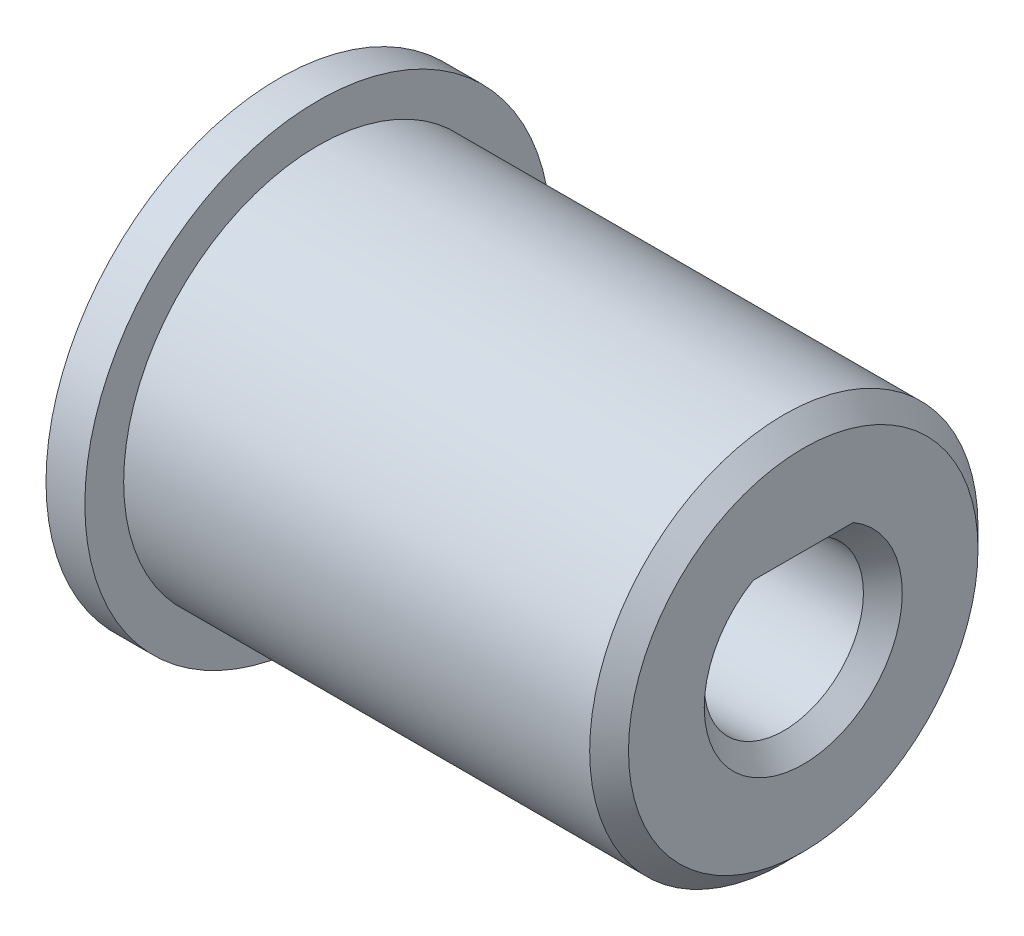
from build123d import *

# Parameters (mm, degrees)
SKIZZE2_R                            = 10
AUFSATZ_LINEAR_AUSTRAGEN1_DEPTH      = 25
SKIZZE3_R                            = 12
AUFSATZ_LINEAR_AUSTRAGEN2_DEPTH      = 2
SCHNITT_LINEAR_AUSTRAGEN1_DEPTH      = 15
FASE1_SIZE                           = 1
FASE2_SIZE                           = 1
F_3_1_3_1_DURCHMESSER_BOHRUNG1_D     = 3.1
F_3_1_3_1_DURCHMESSER_BOHRUNG1_DEPTH = 7
F_3_1_3_1_DURCHMESSER_BOHRUNG1_TIP   = 0.931333959
FASE3_SIZE                           = 1


with BuildPart() as part:
    # Skizze2 → Aufsatz-Linear austragen1 (new body)
    with BuildSketch(Plane(origin=(0, 0, 0), x_dir=(0, 0, -1), z_dir=(1, 0, 0))):
        Circle(SKIZZE2_R)
    extrude(amount=AUFSATZ_LINEAR_AUSTRAGEN1_DEPTH)

    # Skizze3 → Aufsatz-Linear austragen2 (add)
    with BuildSketch(Plane.ZY):
        Circle(SKIZZE3_R)
    extrude(amount=AUFSATZ_LINEAR_AUSTRAGEN2_DEPTH)

    # Skizze4 → Schnitt-Linear austragen1 (cut)
    with BuildSketch(Plane(origin=(25, 0, 0), x_dir=(0, 0, -1), z_dir=(1, 0, 0))):
        with BuildLine():
            Line((-2.291287847, 3.4), (2.291287847, 3.4))
            ThreePointArc((2.291287847, 3.4), (0, -4.1), (-2.291287847, 3.4))
        make_face()
    extrude(amount=-SCHNITT_LINEAR_AUSTRAGEN1_DEPTH, mode=Mode.SUBTRACT)

    # Fase1
    fase1_edges = [part.edges().sort_by_distance(p)[0] for p in [
        (25, 3.4, 0),
        (25, -4.1, 0),
    ]]
    chamfer(fase1_edges, length=FASE1_SIZE)

    # Fase2
    fase2_edges = [part.edges().sort_by_distance(p)[0] for p in [
        (25, 0, 10),
    ]]
    chamfer(fase2_edges, length=FASE2_SIZE)

    # Ø3.1 (3.1) Durchmesser Bohrung1
    with Locations(Plane.ZY.offset(2)):
        with Locations((4.25, 0), (-4.25, 0)):
            Hole(F_3_1_3_1_DURCHMESSER_BOHRUNG1_D / 2, depth=F_3_1_3_1_DURCHMESSER_BOHRUNG1_DEPTH)
            with Locations((0, 0, -(F_3_1_3_1_DURCHMESSER_BOHRUNG1_DEPTH + F_3_1_3_1_DURCHMESSER_BOHRUNG1_TIP / 2))):  # 118° drill point
                Cone(0, F_3_1_3_1_DURCHMESSER_BOHRUNG1_D / 2, F_3_1_3_1_DURCHMESSER_BOHRUNG1_TIP, mode=Mode.SUBTRACT)

    # Fase3
    fase3_edges = [part.edges().sort_by_distance(p)[0] for p in [
        (-2, 0, 5.8),
        (-2, 0, -2.7),
    ]]
    chamfer(fase3_edges, length=FASE3_SIZE)


solid = part.part
